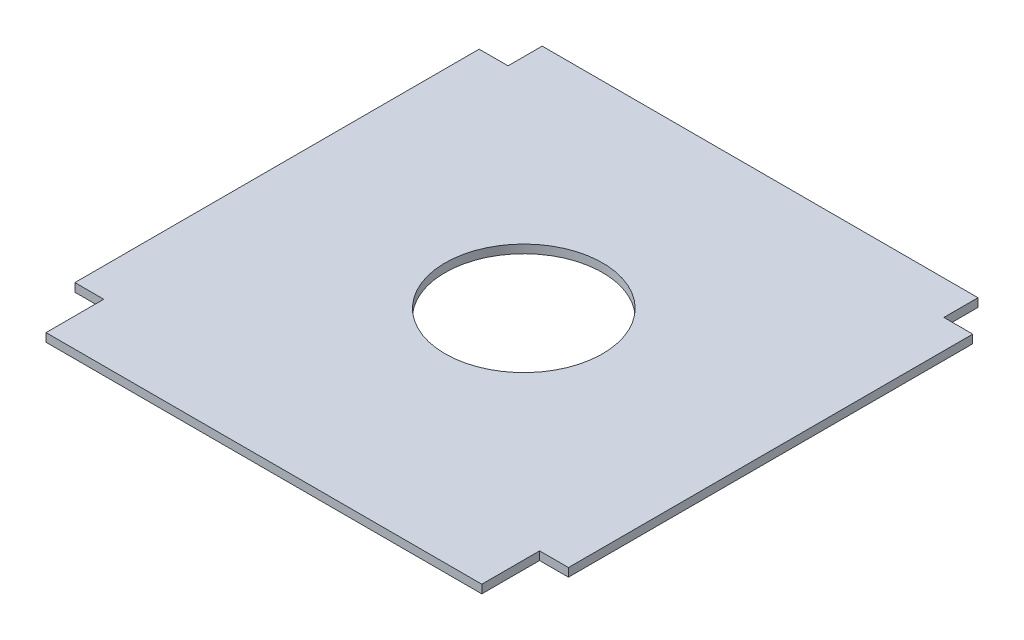
from build123d import *

# Parameters (mm, degrees)
BOSS_EXTRUDE1_DEPTH = 1.6
SKETCH2_R           = 15
CUT_EXTRUDE1_DEPTH  = 1.6


with BuildPart() as part:
    # Sketch1 → Boss-Extrude1 (new body)
    with BuildSketch(Plane(origin=(0, 0, 0), x_dir=(1, 0, 0), z_dir=(0, 1, 0))):
        Polygon((-41.5, 38.5), (-41.5, 45), (41.5, 45), (41.5, 38.5), (47, 38.5), (47, -38.5), (41.5, -38.5), (41.5, -49.5), (-41.5, -49.5), (-41.5, -38.5), (-47, -38.5), (-47, 38.5), align=None)
    extrude(amount=BOSS_EXTRUDE1_DEPTH)

    # Sketch2 → Cut-Extrude1 (cut)
    with BuildSketch(Plane(origin=(0, 1.6, 0), x_dir=(1, 0, 0), z_dir=(0, 1, 0))):
        Circle(SKETCH2_R)
    extrude(amount=-CUT_EXTRUDE1_DEPTH, mode=Mode.SUBTRACT)


solid = part.part
